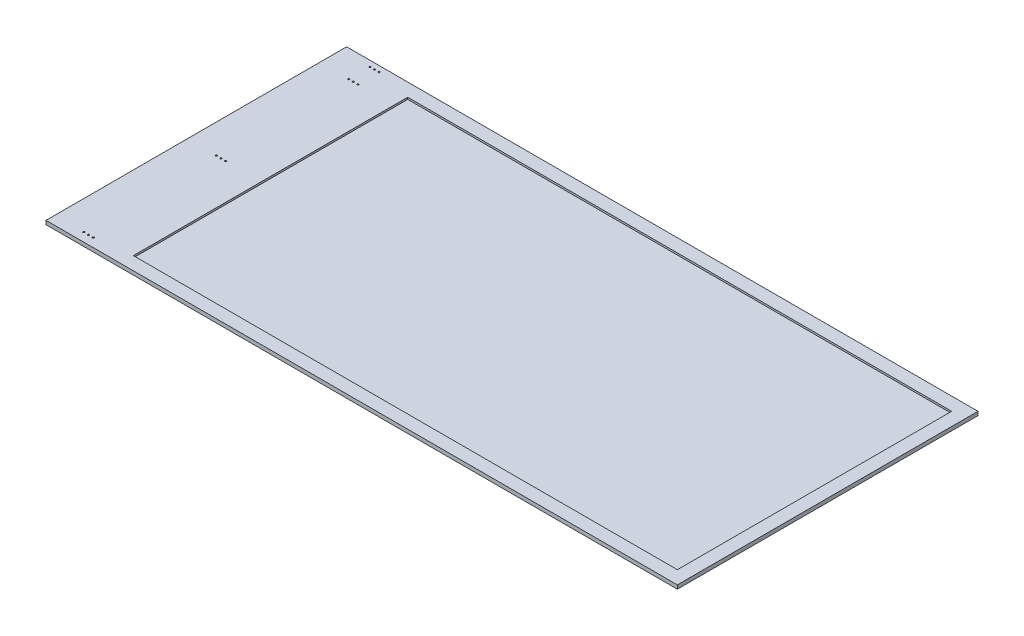
from build123d import *

# Parameters (mm, degrees)
SKETCH1_W           = 1066.8
SKETCH1_H           = 508
BOSS_EXTRUDE1_DEPTH = 6.35
SKETCH2_W           = 919.1625
SKETCH2_H           = 463.55
CUT_EXTRUDE1_DEPTH  = 3.175
SKETCH3_R           = 1.3589
CUT_EXTRUDE2_DEPTH  = 1182.594923186


with BuildPart() as part:
    # Sketch1 → Boss-Extrude1 (new body)
    with BuildSketch(Plane(origin=(0, 0, 0), x_dir=(1, 0, 0), z_dir=(0, 1, 0))):
        with Locations((533.4, 254)):
            Rectangle(SKETCH1_W, SKETCH1_H)
    extrude(amount=BOSS_EXTRUDE1_DEPTH)

    # Sketch2 → Cut-Extrude1 (cut)
    with BuildSketch(Plane(origin=(0, 6.35, 0), x_dir=(1, 0, 0), z_dir=(0, 1, 0))):
        with Locations((584.99375, 254)):
            Rectangle(SKETCH2_W, SKETCH2_H)
    extrude(amount=-CUT_EXTRUDE1_DEPTH, mode=Mode.SUBTRACT)

    # Sketch3 → Cut-Extrude2 (cut, through all)
    with BuildSketch(Plane(origin=(0, 6.35, 0), x_dir=(1, 0, 0), z_dir=(0, 1, 0))):
        with Locations((49.149, 462.4832)):
            Circle(SKETCH3_R)
        with Locations((49.149, 498.094)):
            Circle(SKETCH3_R)
        with Locations((56.8452, 498.094)):
            Circle(SKETCH3_R)
        with Locations((56.8452, 462.4832)):
            Circle(SKETCH3_R)
        with Locations((64.5414, 498.094)):
            Circle(SKETCH3_R)
        with Locations((64.5414, 462.4832)):
            Circle(SKETCH3_R)
        with Locations((49.149, 14.8082)):
            Circle(SKETCH3_R)
        with Locations((57.0992, 14.8082)):
            Circle(SKETCH3_R)
        with Locations((65.0494, 14.8082)):
            Circle(SKETCH3_R)
        with Locations((49.149, 238.6457)):
            Circle(SKETCH3_R)
        with Locations((57.0992, 238.6457)):
            Circle(SKETCH3_R)
        with Locations((65.0494, 238.6457)):
            Circle(SKETCH3_R)
    extrude(amount=-CUT_EXTRUDE2_DEPTH, mode=Mode.SUBTRACT)


solid = part.part
